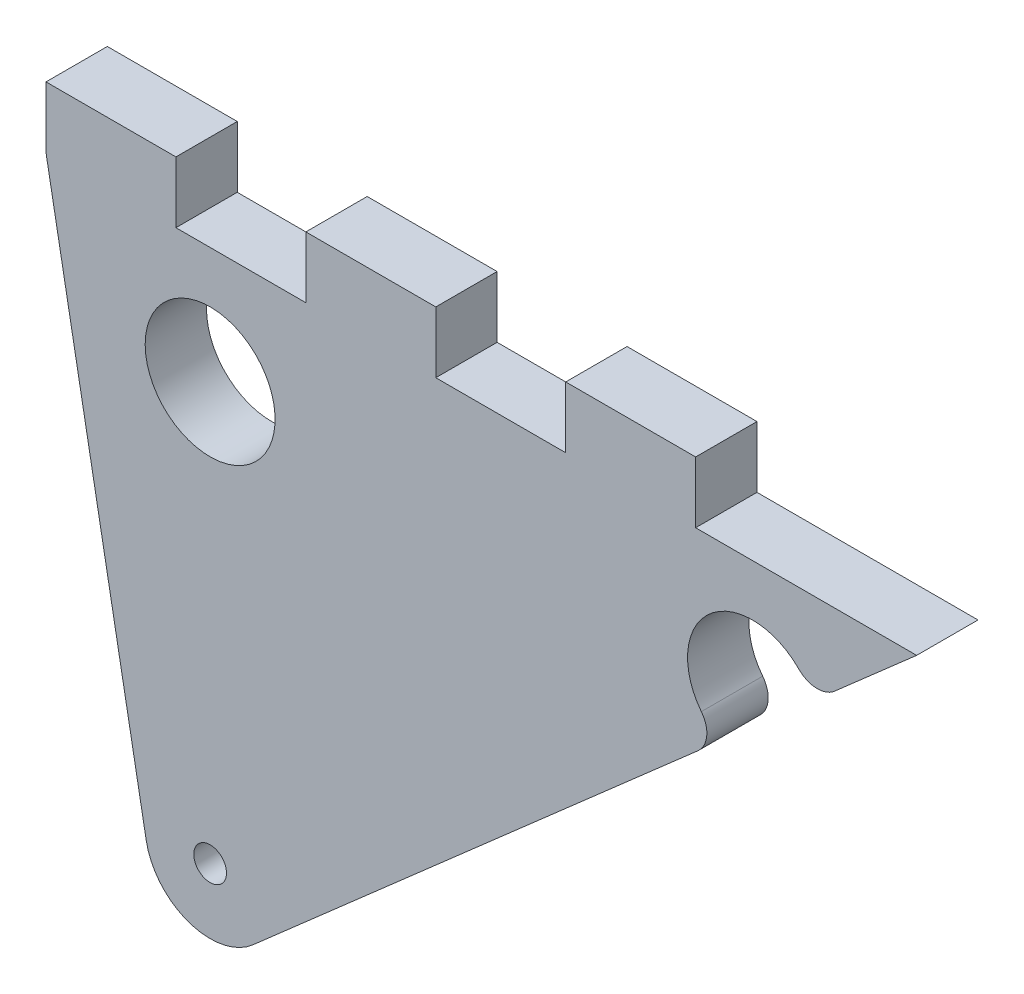
from build123d import *

# Parameters (mm, degrees)
SKETCH1_R           = 1.6
SKETCH1_R_2         = 6.35
BOSS_EXTRUDE1_DEPTH = 5.9944


with BuildPart() as part:
    # Sketch1 → Boss-Extrude1 (new body)
    with BuildSketch(Plane.XY):
        with BuildLine():
            ThreePointArc((316.953796067, 78.675830573), (316.9642742, 78.445354708), (316.995622149, 78.216780382))
            Line((316.995622149, 78.216780382), (326.749772708, 25.13420903))
            ThreePointArc((326.749772708, 25.13420903), (330.912307442, 20.282357802), (337.186376688, 21.508412799))
            Line((337.186376688, 21.508412799), (380.686318009, 59.686636906))
            ThreePointArc((380.686318009, 59.686636906), (381.539726589, 61.358310991), (381.012274461, 63.159586846))
            ThreePointArc((381.012274461, 63.159586846), (381.827165591, 71.841961695), (390.541875435, 71.52335081))
            ThreePointArc((390.541875435, 71.52335081), (392.259481176, 70.76662697), (394.027759373, 71.395906456))
            Line((394.027759373, 71.395906456), (402.058752504, 78.4444))
            Line((402.058752504, 78.4444), (380.453796067, 78.4444))
            Line((380.453796067, 78.4444), (380.453796067, 84.4388))
            Line((380.453796067, 84.4388), (367.753796067, 84.4388))
            Line((367.753796067, 84.4388), (367.753796067, 78.4444))
            Line((367.753796067, 78.4444), (355.053796067, 78.4444))
            Line((355.053796067, 78.4444), (355.053796067, 84.4388))
            Line((355.053796067, 84.4388), (342.353796067, 84.4388))
            Line((342.353796067, 84.4388), (342.353796067, 78.4444))
            Line((342.353796067, 78.4444), (329.653796067, 78.4444))
            Line((329.653796067, 78.4444), (329.653796067, 84.4388))
            Line((329.653796067, 84.4388), (316.953796067, 84.4388))
            Line((316.953796067, 84.4388), (316.953796067, 78.675830573))
        make_face()
        with Locations((332.996689228, 26.282106781)):
            Circle(SKETCH1_R, mode=Mode.SUBTRACT)
        with Locations((332.996689286, 67.0694)):
            Circle(SKETCH1_R_2, mode=Mode.SUBTRACT)
    extrude(amount=BOSS_EXTRUDE1_DEPTH)


solid = part.part
